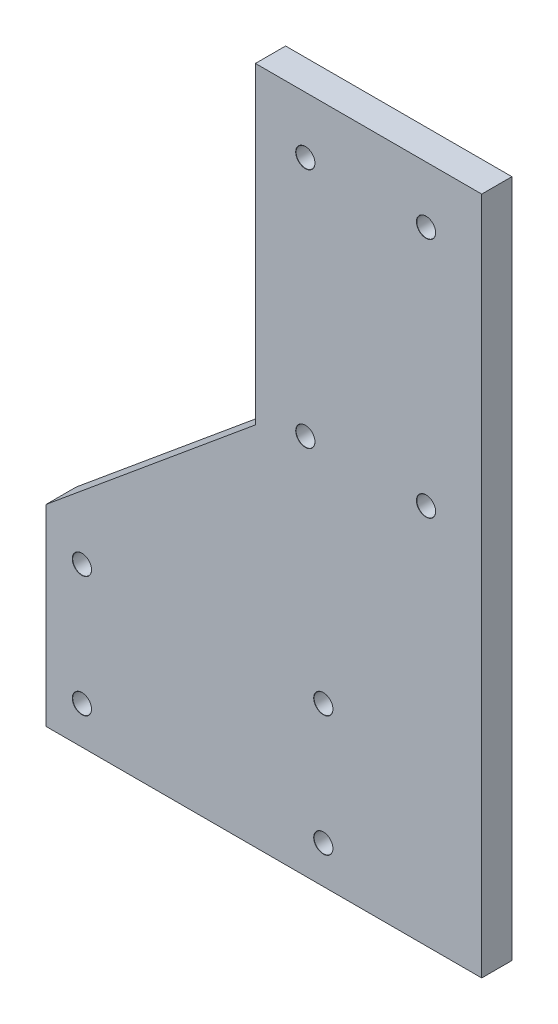
from build123d import *

# Parameters (mm, degrees)
EXTRUDE_1_DEPTH       = 4
F_2_5MM_1_D           = 2.5
F_2_5MM_1_CSINK_D     = 2.55
F_2_5MM_1_CSINK_ANGLE = 90


with BuildPart() as part:
    # 草图1 → 凸台-拉伸1 (new body)
    with BuildSketch(Plane.XY):
        Polygon((0, 0), (-41.5, 0), (-41.5, 25.5), (-13.75, 48.5), (-13.75, 90), (16.25, 90), (16.25, 0), align=None)
    extrude(amount=EXTRUDE_1_DEPTH)

    # Ø2.5mm 暗销孔1 (through all)
    with Locations(Plane.XY.offset(4)):
        with Locations((8.866379665, 50.5), (-36.75, 5), (-36.75, 21), (-4.75, 5), (-4.75, 21), (-7.133620335, 82.5), (8.866379665, 82.5), (-7.133620335, 50.5)):
            CounterSinkHole(F_2_5MM_1_D / 2, F_2_5MM_1_CSINK_D / 2, counter_sink_angle=F_2_5MM_1_CSINK_ANGLE)


solid = part.part
